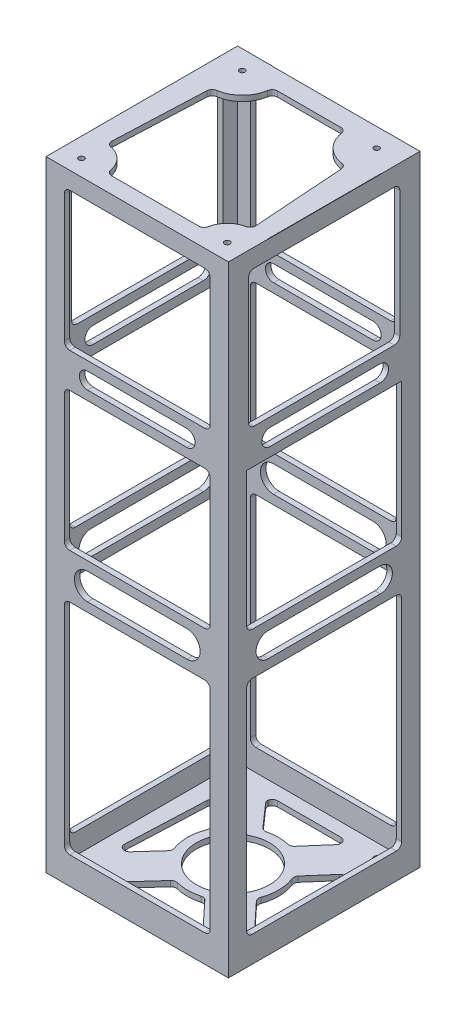
from build123d import *

# Parameters (mm, degrees)
SKETCH1_W           = 100
SKETCH1_H           = 105
BODY_DEPTH          = 337
SHELL1_T            = -3
SKETCH8_W           = 100
SKETCH8_H           = 105
SKETCH8_R           = 20
SCOPEEND_DEPTH      = 3
ALUHOLES_DEPTH      = 345.710385686
ALUHOLES_DEPTH_BACK = 345.710385686
SKETCH5_R           = 1.5
CUT_EXTRUDE3_DEPTH  = 3
FILLET1_R           = 3
SKETCH9_W           = 80
SKETCH9_H           = 76
SKETCH9_H_2         = 120
CUT_EXTRUDE4_DEPTH  = 357.50245441
SKETCH10_W          = 85
SKETCH10_H          = 76.904761904
SKETCH10_W_2        = 82.894736842
SKETCH10_H_2        = 75
SKETCH10_H_3        = 121.428571428
CUT_EXTRUDE5_DEPTH  = 356.422635745
FILLET2_R           = 3
SKETCH11_W          = 62.22
SKETCH11_H          = 0.1
CUT_EXTRUDE6_DEPTH  = 0.1
SKETCH12_W          = 62.22
SKETCH12_H          = 0.1
CUT_EXTRUDE7_DEPTH  = 0.1
CUT_EXTRUDE8_DEPTH  = 357.50245441
CUT_EXTRUDE9_DEPTH  = 356.422635745
CUT_EXTRUDE10_START = -10
CUT_EXTRUDE10_DEPTH = 10
FILLET3_R           = 3


with BuildPart() as part:
    # Sketch1 → Body (new body)
    with BuildSketch(Plane(origin=(0, 0, 0), x_dir=(1, 0, 0), z_dir=(0, 1, 0))):
        Rectangle(SKETCH1_W, SKETCH1_H)
    extrude(amount=BODY_DEPTH)

    # Shell1
    shell1_openings = [part.faces().sort_by_distance(p)[0] for p in [
        (0, 0, 0),
    ]]
    offset(amount=SHELL1_T, openings=shell1_openings, kind=Kind.INTERSECTION)

    # Sketch8 → ScopeEnd (add)
    with BuildSketch(Plane.XZ):
        Rectangle(SKETCH8_W, SKETCH8_H)
        with Locations(Location((0, 0, 0), (0, 0, 270))):
            Circle(SKETCH8_R, mode=Mode.SUBTRACT)
    extrude(amount=SCOPEEND_DEPTH)

    # Sketch5 → AluHoles (cut, two sides: drawn at the far end of the back side and taken through both)
    with BuildSketch(Plane.XZ.offset(-334).offset(-ALUHOLES_DEPTH_BACK)):
        with Locations(Location((36.63093649, -42.14090324, 0), (0, 0, 270))):
            Circle(SKETCH5_R)
        with Locations(Location((-37.03906351, -42.14090324, 0), (0, 0, 270))):
            Circle(SKETCH5_R)
        with Locations(Location((-39.43906351, 43.64909676, 0), (0, 0, 270))):
            Circle(SKETCH5_R)
        with Locations(Location((40.53093649, 43.64909676, 0), (0, 0, 270))):
            Circle(SKETCH5_R)
    extrude(amount=ALUHOLES_DEPTH + ALUHOLES_DEPTH_BACK, mode=Mode.SUBTRACT)

    # Sketch6 → Cut-Extrude3 (cut)
    with BuildSketch(Plane(origin=(0, 337, 0), x_dir=(1, 0, 0), z_dir=(0, 1, 0))):
        with BuildLine():
            Line((-37.03906351, 25.548834038), (-39.43906351, -29.869696639))
            ThreePointArc((-39.43906351, -29.869696639), (-29.695556243, -33.905589494), (-25.659663388, -43.64909676))
            Line((-25.659663388, -43.64909676), (27.56939137, -43.64909676))
            ThreePointArc((27.56939137, -43.64909676), (31.365740041, -34.483900311), (40.53093649, -30.68755164))
            Line((40.53093649, -30.68755164), (36.63093649, 25.228104985))
            ThreePointArc((36.63093649, 25.228104985), (24.671782155, 30.181748905), (19.718138235, 42.14090324))
            Line((19.718138235, 42.14090324), (-20.446994308, 42.14090324))
            ThreePointArc((-20.446994308, 42.14090324), (-25.306698863, 30.408538593), (-37.03906351, 25.548834038))
        make_face()
    extrude(amount=-CUT_EXTRUDE3_DEPTH, mode=Mode.SUBTRACT)

    # Fillet1
    fillet1_edges = [part.edges().sort_by_distance(p)[0] for p in [
        (-37.03906351, 335.5, -25.548834038),
        (-20.446994308, 335.5, -42.14090324),
        (19.718138235, 335.5, -42.14090324),
        (36.63093649, 335.5, -25.228104985),
        (40.53093649, 335.5, 30.68755164),
        (27.56939137, 335.5, 43.64909676),
        (-25.659663388, 335.5, 43.64909676),
        (-39.43906351, 335.5, 29.869696639),
    ]]
    fillet(fillet1_edges, radius=FILLET1_R)

    # Sketch9 → Cut-Extrude4 (cut, through all)
    with BuildSketch(Plane.XY.offset(52.5)):
        with Locations((0, 194.5)):
            Rectangle(SKETCH9_W, SKETCH9_H)
        with Locations((0, 289.5)):
            Rectangle(SKETCH9_W, SKETCH9_H)
        with Locations((0, 72)):
            Rectangle(SKETCH9_W, SKETCH9_H_2)
    extrude(amount=-CUT_EXTRUDE4_DEPTH, mode=Mode.SUBTRACT)

    # Sketch10 → Cut-Extrude5 (cut, through all)
    with BuildSketch(Plane(origin=(50, 0, 0), x_dir=(0, 0, -1), z_dir=(1, 0, 0))):
        with Locations((0, 194.5)):
            Rectangle(SKETCH10_W, SKETCH10_H)
        with Locations((0, 289.5)):
            Rectangle(SKETCH10_W_2, SKETCH10_H_2)
        with Locations((0, 72)):
            Rectangle(SKETCH10_W, SKETCH10_H_3)
    extrude(amount=-CUT_EXTRUDE5_DEPTH, mode=Mode.SUBTRACT)

    # Fillet2
    fillet2_edges = [part.edges().sort_by_distance(p)[0] for p in [
        (40, 156.5, 51),
        (-40, 156.5, 51),
        (-40, 232.5, 51),
        (40, 232.5, 51),
        (40, 156.5, -51),
        (-40, 156.5, -51),
        (-40, 232.5, -51),
        (40, 232.5, -51),
        (40, 251.5, 51),
        (-40, 251.5, 51),
        (-40, 327.5, 51),
        (40, 327.5, 51),
        (40, 251.5, -51),
        (-40, 251.5, -51),
        (-40, 327.5, -51),
        (40, 327.5, -51),
        (40, 12, 51),
        (-40, 12, 51),
        (-40, 132, 51),
        (40, 132, 51),
        (40, 12, -51),
        (-40, 12, -51),
        (-40, 132, -51),
        (40, 132, -51),
        (-48.5, 156.047619048, 42.5),
        (-48.5, 232.952380952, -42.5),
        (-48.5, 156.047619048, -42.5),
        (48.5, 156.047619048, 42.5),
        (48.5, 156.047619048, -42.5),
        (-48.5, 252, 41.447368421),
        (-48.5, 327, 41.447368421),
        (-48.5, 327, -41.447368421),
        (-48.5, 252, -41.447368421),
        (48.5, 252, 41.447368421),
        (48.5, 327, 41.447368421),
        (48.5, 327, -41.447368421),
        (48.5, 252, -41.447368421),
        (-48.5, 132.714285714, -42.5),
        (-48.5, 11.285714286, -42.5),
        (-48.5, 11.285714286, 42.5),
        (-48.5, 132.714285714, 42.5),
        (48.5, 132.714285714, -42.5),
        (48.5, 11.285714286, -42.5),
        (48.5, 11.285714286, 42.5),
        (48.5, 132.714285714, 42.5),
    ]]
    fillet(fillet2_edges, radius=FILLET2_R)

    # Sketch11 → Cut-Extrude6 (cut)
    with BuildSketch(Plane(origin=(0, 0, -52.5), x_dir=(-1, 0, 0), z_dir=(0, 0, -1))):
        with Locations((0, 336.95)):
            Rectangle(SKETCH11_W, SKETCH11_H)
    extrude(amount=-CUT_EXTRUDE6_DEPTH, mode=Mode.SUBTRACT)

    # Sketch12 → Cut-Extrude7 (cut)
    with BuildSketch(Plane(origin=(50, 0, 0), x_dir=(0, 0, -1), z_dir=(1, 0, 0))):
        with Locations((0, 336.95)):
            Rectangle(SKETCH12_W, SKETCH12_H)
    extrude(amount=-CUT_EXTRUDE7_DEPTH, mode=Mode.SUBTRACT)

    # Sketch13 → Cut-Extrude8 (cut, through all)
    with BuildSketch(Plane(origin=(0, 0, -52.5), x_dir=(-1, 0, 0), z_dir=(0, 0, -1))):
        with BuildLine():
            Line((-27.21609863, 246.5), (27.21609863, 246.5))
            ThreePointArc((27.21609863, 246.5), (31.71609863, 242), (27.21609863, 237.5))
            Line((27.21609863, 237.5), (-27.21609863, 237.5))
            ThreePointArc((-27.21609863, 237.5), (-31.71609863, 242), (-27.21609863, 246.5))
        make_face()
        with BuildLine():
            Line((-27.21609863, 151.5), (27.21609863, 151.5))
            ThreePointArc((27.21609863, 151.5), (34.46609863, 144.25), (27.21609863, 137))
            Line((27.21609863, 137), (-27.21609863, 137))
            ThreePointArc((-27.21609863, 137), (-34.46609863, 144.25), (-27.21609863, 151.5))
        make_face()
    extrude(amount=-CUT_EXTRUDE8_DEPTH, mode=Mode.SUBTRACT)

    # Sketch14 → Cut-Extrude9 (cut, through all)
    with BuildSketch(Plane(origin=(50, 0, 0), x_dir=(0, 0, -1), z_dir=(1, 0, 0))):
        with BuildLine():
            Line((-29.665509162, 247), (30.718140741, 247))
            ThreePointArc((30.718140741, 247), (35.241950264, 242.476190476), (30.718140741, 237.952380952))
            Line((30.718140741, 237.952380952), (-29.665509162, 237.952380952))
            ThreePointArc((-29.665509162, 237.952380952), (-34.189318685, 242.476190476), (-29.665509162, 247))
        make_face()
        with BuildLine():
            Line((-30.718140741, 151.047619048), (30.718140741, 151.047619048))
            ThreePointArc((30.718140741, 151.047619048), (37.384807407, 144.380952381), (30.718140741, 137.714285714))
            Line((30.718140741, 137.714285714), (-30.718140741, 137.714285714))
            ThreePointArc((-30.718140741, 137.714285714), (-37.384807407, 144.380952381), (-30.718140741, 151.047619048))
        make_face()
    extrude(amount=-CUT_EXTRUDE9_DEPTH, mode=Mode.SUBTRACT)

    # Sketch15 → Cut-Extrude10 (cut)
    with BuildSketch(Plane.XZ.offset(3).offset(CUT_EXTRUDE10_START)):
        with BuildLine():
            Line((-22.781042327, 10.296800984), (-39.38735993, 28.675806452))
            Line((-39.38735993, 28.675806452), (-37.03906351, -25.548834038))
            ThreePointArc((-37.03906351, -25.548834038), (-36.423835623, -25.560244174), (-35.809453904, -25.59445889))
            Line((-35.809453904, -25.59445889), (-22.63764813, -10.608340451))
            ThreePointArc((-22.63764813, -10.608340451), (-24.999411899, -0.17147794), (-22.781042327, 10.296800984))
        make_face()
        with BuildLine():
            ThreePointArc((-25.659663388, 43.64909676), (-25.660650749, 43.48414374), (-25.663612689, 43.31921436))
            Line((-25.663612689, 43.31921436), (-7.941369594, 23.705160809))
            ThreePointArc((-7.941369594, 23.705160809), (0.170017908, 24.999421872), (8.263051714, 23.594956588))
            Line((8.263051714, 23.594956588), (26.884584392, 43.64909676))
            Line((26.884584392, 43.64909676), (-25.659663388, 43.64909676))
        make_face()
        with BuildLine():
            ThreePointArc((35.22991464, -25.28623378), (35.929822879, -25.242643432), (36.63093649, -25.228104985))
            Line((36.63093649, -25.228104985), (40.400121604, 28.812013119))
            Line((40.400121604, 28.812013119), (22.918983099, 9.986000888))
            ThreePointArc((22.918983099, 9.986000888), (24.996636015, -0.410107193), (22.579065694, -10.732464414))
            Line((22.579065694, -10.732464414), (35.22991464, -25.28623378))
        make_face()
        with BuildLine():
            ThreePointArc((-20.446994308, -42.14090324), (-20.5322756, -40.460809999), (-20.787242804, -38.797987724))
            Line((-20.787242804, -38.797987724), (-7.61543703, -23.811869285))
            ThreePointArc((-7.61543703, -23.811869285), (-0.068626999, -24.999905807), (7.484591781, -23.853320228))
            Line((7.484591781, -23.853320228), (20.135440727, -38.407089594))
            ThreePointArc((20.135440727, -38.407089594), (19.822787622, -40.262372849), (19.718138235, -42.14090324))
            Line((19.718138235, -42.14090324), (-20.446994308, -42.14090324))
        make_face()
    extrude(amount=CUT_EXTRUDE10_DEPTH, mode=Mode.SUBTRACT)

    # Fillet3
    # the kernel refuses this fillet: 3 mm, written as the material it adds along each edge
    with BuildSketch(Plane(origin=(-37.03906351, 0, -25.548834038), x_dir=(0.9972764529260022, 0, -0.07375416218310218), z_dir=(0, -1, 0))) as fillet3_piece_1:
        with BuildLine():
            CenterArc((2.668730812, 2.991829359), FILLET3_R, 186.709390991, 79.06096622)
            Line((-0.310723728, 2.641328799), (0, 0))
            ThreePointArc((0, 0), (1.223734163, 0.045189282), (2.447468326, 0))
        make_face()
    extrude(amount=3)
    with BuildSketch(Plane(origin=(-35.809453904, 0, -25.59445889), x_dir=(0.6601764416805548, 0, 0.7511105550117114), z_dir=(0, -1, 0))) as fillet3_piece_2:
        with BuildLine():
            CenterArc((1.417766034, 3), FILLET3_R, 221.569940112, 48.430059888)
            ThreePointArc((-0.826672903, 1.009398619), (-0.403410897, 0.512828098), (0, 0))
            Line((0, 0), (1.417766034, 0))
        make_face()
    extrude(amount=3)
    with BuildSketch(Plane(origin=(-22.781042327, 0, 10.296800984), x_dir=(-0.3791263093529184, 0, -0.9253449311237595), z_dir=(0, -1, 0)), Plane(origin=(8.263051714, 0, 23.594956588), x_dir=(-0.95498084479142, 0, 0.2966674671774203), z_dir=(0, -1, 0))) as fillet3_piece_3:
        with BuildLine():
            CenterArc((1.889344206, -2.998093224), FILLET3_R, 92.042913009, 62.335995504)
            Line((-0.815676017, -1.700840129), (0, 0))
            ThreePointArc((0, 0), (0.891200097, -0.015889802), (1.782400194, 0))
        make_face()
    extrude(amount=3)
    with BuildSketch(Plane(origin=(-22.63764813, 0, -10.608340451), x_dir=(-0.39178443622254033, 0, 0.9200570392827752), z_dir=(0, -1, 0)), Plane(origin=(7.484591781, 0, -23.853320228), x_dir=(-0.9641988001215861, 0, -0.2651804552452794), z_dir=(0, -1, 0)), Plane(origin=(-7.941369594, 0, 23.705160809), x_dir=(0.9589275188236495, 0, 0.28365121829937434), z_dir=(0, -1, 0))) as fillet3_piece_4:
        with BuildLine():
            CenterArc((1.889344206, 2.998093224), FILLET3_R, 205.621091487, 62.335995504)
            Line((-0.815676017, 1.700840129), (0, 0))
            ThreePointArc((0, 0), (0.891200097, 0.015889802), (1.782400194, 0))
        make_face()
    extrude(amount=3)
    with BuildSketch(Plane(origin=(20.135440727, 0, -38.407089594), x_dir=(-0.6560427906845355, 0, 0.7547236956601049), z_dir=(0, -1, 0))) as fillet3_piece_5:
        with BuildLine():
            CenterArc((1.444001964, 3), FILLET3_R, 220.756558716, 49.243441284)
            ThreePointArc((-0.828468807, 1.041460597), (-0.403986975, 0.528881999), (0, 0))
            Line((0, 0), (1.444001964, 0))
        make_face()
    extrude(amount=3)
    with BuildSketch(Plane(origin=(19.718138235, 0, -42.14090324), x_dir=(0.07554431052844701, 0, 0.9971424457652887), z_dir=(0, -1, 0))) as fillet3_piece_6:
        with BuildLine():
            CenterArc((2.781964298, 2.991427337), FILLET3_R, 184.332497729, 81.335004543)
            Line((-0.209463039, 2.764794406), (0, 0))
            ThreePointArc((0, 0), (1.277665683, 0.048329238), (2.555331367, 0))
        make_face()
    extrude(amount=3)
    with BuildSketch(Plane(origin=(-7.61543703, 0, -23.811869285), x_dir=(-0.6601764416805559, 0, -0.7511105550117103), z_dir=(0, -1, 0)), Plane(origin=(22.579065694, 0, -10.732464414), x_dir=(0.6560427906849081, 0, -0.754723695659781), z_dir=(0, -1, 0))) as fillet3_piece_7:
        with BuildLine():
            CenterArc((1.88631506, 3), FILLET3_R, 207.664004496, 62.335995504)
            ThreePointArc((-0.77074139, 1.607142857), (-0.371043283, 0.81044246), (0, 0))
            Line((0, 0), (1.88631506, 0))
        make_face()
    extrude(amount=3)
    with BuildSketch(Plane(origin=(-20.787242804, 0, -38.797987724), x_dir=(0.16280985040843823, 0, -0.9866574646806164), z_dir=(0, -1, 0))) as fillet3_piece_8:
        with BuildLine():
            CenterArc((1.422664123, 2.997680323), FILLET3_R, 219.316641588, 48.430059888)
            Line((-0.89830451, 1.096863499), (0, 0))
            ThreePointArc((0, 0), (0.65235605, 0.012829413), (1.304712099, 0))
        make_face()
    extrude(amount=3)
    with BuildSketch(Plane(origin=(-20.446994308, 0, -42.14090324), x_dir=(-0.07678831532182857, 0, 0.9970474184461015), z_dir=(0, -1, 0))) as fillet3_piece_9:
        with BuildLine():
            CenterArc((2.778519029, -2.991142255), FILLET3_R, 94.403981609, 81.192036781)
            Line((-0.212623226, -2.760777309), (0, 0))
            ThreePointArc((0, 0), (1.274077042, -0.048989437), (2.548154083, 0))
        make_face()
    extrude(amount=3)
    with BuildSketch(Plane(origin=(36.63093649, 0, -25.228104985), x_dir=(0.06957886939402504, 0, 0.9975764536785385), z_dir=(0, -1, 0))) as fillet3_piece_10:
        with BuildLine():
            CenterArc((2.598016027, 3), FILLET3_R, 192.107890196, 77.892109804)
            ThreePointArc((-0.335247056, 2.370740366), (-0.125617948, 1.191310204), (0, 0))
            Line((0, 0), (2.598016027, 0))
        make_face()
    extrude(amount=3)
    with BuildSketch(Plane(origin=(35.22991464, 0, -25.28623378), x_dir=(0.9990505346923116, 0, 0.043566376151869604), z_dir=(0, -1, 0))) as fillet3_piece_11:
        with BuildLine():
            CenterArc((1.448817549, 2.997677332), FILLET3_R, 218.501807446, 49.243441284)
            Line((-0.898948007, 1.130059358), (0, 0))
            ThreePointArc((0, 0), (0.665394759, 0.013094274), (1.330789518, 0))
        make_face()
    extrude(amount=3)
    with BuildSketch(Plane(origin=(22.918983099, 0, 9.986000888), x_dir=(0.6804477850028836, 0, 0.7327965692364216), z_dir=(0, -1, 0))) as fillet3_piece_12:
        with BuildLine():
            CenterArc((1.88631506, -3), FILLET3_R, 90, 62.335995504)
            ThreePointArc((-0.77074139, -1.607142857), (-0.371043283, -0.81044246), (0, 0))
            Line((0, 0), (1.88631506, 0))
        make_face()
    extrude(amount=3)
    with BuildSketch(Plane(origin=(-39.38735993, 0, 28.675806452), x_dir=(0.043266260496117294, 0, -0.9990635769072368), z_dir=(0, -1, 0))) as fillet3_piece_13:
        with BuildLine():
            CenterArc((FILLET3_R * 2.77611800821, FILLET3_R), FILLET3_R, 129.619585564, 140.380414436)
            Line((FILLET3_R * 2.13843066918, FILLET3_R * 1.77029530548), (0, 0))
            Line((0, 0), (FILLET3_R * 2.77611800821, 0))
        make_face()
    extrude(amount=3)
    with BuildSketch(Plane(origin=(40.400121604, 0, 28.812013119), x_dir=(-0.6804477850028849, 0, -0.7327965692364203), z_dir=(0, -1, 0))) as fillet3_piece_14:
        with BuildLine():
            CenterArc((FILLET3_R * 2.83264212452, FILLET3_R), FILLET3_R, 128.888845225, 141.111154775)
            Line((FILLET3_R * 2.20483059303, FILLET3_R * 1.77836539037), (0, 0))
            Line((0, 0), (FILLET3_R * 2.83264212452, 0))
        make_face()
    extrude(amount=3)
    with BuildSketch(Plane(origin=(26.884584392, 0, 43.64909676), x_dir=(-1, 0, 0), z_dir=(0, -1, 0))) as fillet3_piece_15:
        with BuildLine():
            CenterArc((FILLET3_R * 2.29319821564, FILLET3_R), FILLET3_R, 137.12135554, 132.87864446)
            Line((FILLET3_R * 1.56040164641, FILLET3_R * 1.680447785), (0, 0))
            Line((0, 0), (FILLET3_R * 2.29319821564, 0))
        make_face()
    extrude(amount=3)
    with BuildSketch(Plane(origin=(-25.659663388, 0, 43.64909676), x_dir=(-0.08975762356605811, 0, -0.9959636383983975), z_dir=(0, -1, 0))) as fillet3_piece_16:
        with BuildLine():
            CenterArc((2.742885289, 2.987890915), FILLET3_R, 185.14966351, 79.700672979)
            Line((-0.245005626, 2.718618044), (0, 0))
            ThreePointArc((0, 0), (1.236806209, 0.055618642), (2.473612418, 0))
        make_face()
    extrude(amount=3)
    with BuildSketch(Plane(origin=(-25.663612689, 0, 43.31921436), x_dir=(0.6704179912233293, 0, -0.7419836366417225), z_dir=(0, -1, 0))) as fillet3_piece_17:
        with BuildLine():
            CenterArc((1.128799459, 3), FILLET3_R, 230.783235001, 39.216764999)
            ThreePointArc((-0.767968624, 0.675721437), (-0.37771181, 0.344989521), (0, 0))
            Line((0, 0), (1.128799459, 0))
        make_face()
    extrude(amount=3)


solid = part.part
